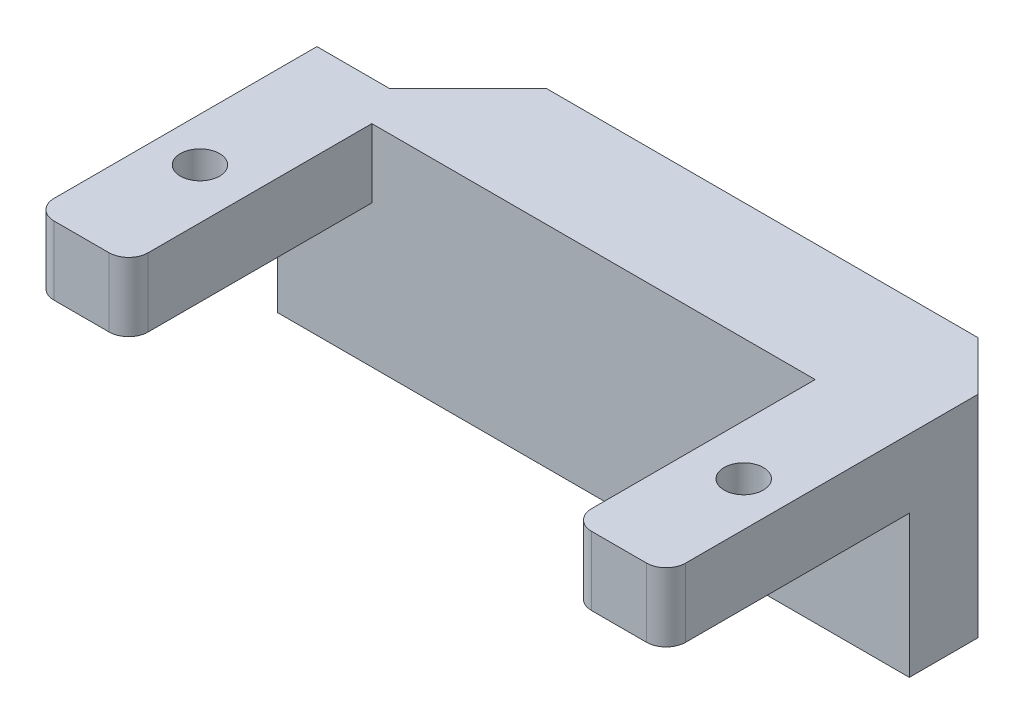
from build123d import *

# Parameters (mm, degrees)
SKETCH1_W           = 32.2
SKETCH1_H           = 25.5
BOSS_EXTRUDE1_DEPTH = 14.4
SKETCH3_W           = 32.2
SKETCH3_H           = 21.75
CUT_EXTRUDE1_DEPTH  = 12.4
SKETCH5_W           = 22.6
SKETCH5_H           = 2
CUT_EXTRUDE2_DEPTH  = 14.4
FILLET1_R           = 1
FILLET2_R           = 1
FILLET3_R           = 1
FILLET4_R           = 1
SKETCH10_R          = 1
CUT_EXTRUDE3_DEPTH  = 10
SKETCH11_W          = 4.85
SKETCH11_H          = 1.75
CUT_EXTRUDE4_DEPTH  = 20
FILLET5_R           = 1
SKETCH12_W          = 20
SKETCH12_H          = 2
BOSS_EXTRUDE2_DEPTH = 5
BOSS_EXTRUDE3_DEPTH = 5
SKETCH14_W          = 37.842545744
SKETCH14_H          = 22.134319208
CUT_EXTRUDE5_DEPTH  = 28.030214576
BOSS_EXTRUDE5_DEPTH = 3.75
CHAMFER1_SIZE       = 5
BOSS_EXTRUDE6_START = 1.5
SKETCH16_R          = 1
BOSS_EXTRUDE6_DEPTH = 1.5
SKETCH17_W          = 31.920460338
SKETCH17_H          = 22.260321026
CUT_EXTRUDE6_DEPTH  = 1


with BuildPart() as part:
    # Sketch1 → Boss-Extrude1 (new body)
    with BuildSketch(Plane.XY):
        Rectangle(SKETCH1_W, SKETCH1_H)
    extrude(amount=BOSS_EXTRUDE1_DEPTH)

    # Sketch3 → Cut-Extrude1 (cut)
    with BuildSketch(Plane.XY.offset(14.4)):
        with Locations((0, -0.125)):
            Rectangle(SKETCH3_W, SKETCH3_H)
    extrude(amount=-CUT_EXTRUDE1_DEPTH, mode=Mode.SUBTRACT)

    # Sketch5 → Cut-Extrude2 (cut)
    with BuildSketch(Plane.XY.offset(14.4)):
        with Locations((0, 11.75)):
            Rectangle(SKETCH5_W, SKETCH5_H)
    extrude(amount=-CUT_EXTRUDE2_DEPTH, mode=Mode.SUBTRACT)

    # Fillet1
    fillet1_edges = [part.edges().sort_by_distance(p)[0] for p in [
        (-11.3, 11.75, 14.4),
    ]]
    fillet(fillet1_edges, radius=FILLET1_R)

    # Fillet2
    fillet2_edges = [part.edges().sort_by_distance(p)[0] for p in [
        (-16.1, 11.75, 14.4),
    ]]
    fillet(fillet2_edges, radius=FILLET2_R)

    # Fillet3
    fillet3_edges = [part.edges().sort_by_distance(p)[0] for p in [
        (11.3, 11.75, 14.4),
    ]]
    fillet(fillet3_edges, radius=FILLET3_R)

    # Fillet4
    fillet4_edges = [part.edges().sort_by_distance(p)[0] for p in [
        (16.1, 11.75, 14.4),
    ]]
    fillet(fillet4_edges, radius=FILLET4_R)

    # Sketch10 → Cut-Extrude3 (cut)
    with BuildSketch(Plane(origin=(0, 12.75, 0), x_dir=(1, 0, 0), z_dir=(0, 1, 0))):
        with Locations(Location((-13.86, -8.203047487, 0), (0, 0, 270))):
            Circle(SKETCH10_R)
    cut_extrude3 = extrude(amount=-CUT_EXTRUDE3_DEPTH, mode=Mode.SUBTRACT)

    # Mirror1: Cut-Extrude3 across plane
    add(cut_extrude3.mirror(Plane(origin=(0, 0, 0), x_dir=(0, 0, 1), z_dir=(1, 0, 0))), mode=Mode.SUBTRACT)

    # Sketch11 → Cut-Extrude4 (cut)
    with BuildSketch(Plane.XY.offset(14.4)):
        with Locations((-13.675, -11.875)):
            Rectangle(SKETCH11_W, SKETCH11_H)
    cut_extrude4 = extrude(amount=-CUT_EXTRUDE4_DEPTH, mode=Mode.SUBTRACT)

    # Mirror2: Cut-Extrude4 across plane
    add(cut_extrude4.mirror(Plane(origin=(0, 0, 0), x_dir=(0, 0, 1), z_dir=(1, 0, 0))), mode=Mode.SUBTRACT)

    # Fillet5
    fillet5_edges = [part.edges().sort_by_distance(p)[0] for p in [
        (16.1, -11, 1),
        (11.25, -11.875, 14.4),
        (11.25, -11.875, 0),
        (-11.25, -11.875, 0),
        (-16.1, -11, 1),
        (-11.25, -11.875, 14.4),
    ]]
    fillet(fillet5_edges, radius=FILLET5_R)

    # Sketch12 → Boss-Extrude2 (add)
    with BuildSketch(Plane(origin=(0, 0, 0), x_dir=(-1, 0, 0), z_dir=(0, 0, -1))):
        with Locations((-2.6, 4.5)):
            Rectangle(SKETCH12_W, SKETCH12_H)
    extrude(amount=BOSS_EXTRUDE2_DEPTH)

    # Sketch13 → Boss-Extrude3 (add)
    with BuildSketch(Plane(origin=(0, 0, 0), x_dir=(-1, 0, 0), z_dir=(0, 0, -1))):
        Polygon((-12.6, 9), (7.4, 9), (7.4, 7), (7.4, 5.5), (6.4, 5.5), (6.4, 7), (-11.6, 7), (-11.6, 5.5), (-12.6, 5.5), (-12.6, 7), align=None)
    extrude(amount=BOSS_EXTRUDE3_DEPTH)

    # Sketch14 → Cut-Extrude5 (cut, through all)
    with BuildSketch(Plane.XZ.offset(-3.5)):
        with Locations((-0.315004543, 4.826001817)):
            Rectangle(SKETCH14_W, SKETCH14_H)
    extrude(amount=CUT_EXTRUDE5_DEPTH, mode=Mode.SUBTRACT)

    # Sketch15 → Boss-Extrude5 (add)
    with BuildSketch(Plane(origin=(0, 12.75, 0), x_dir=(1, 0, 0), z_dir=(0, 1, 0))):
        Polygon((11.3, 0), (12.6, 0), (12.6, 5), (-7.4, 5), (-7.4, 0), (-11.3, 0), (-11.3, -2), (11.3, -2), align=None)
    extrude(amount=-BOSS_EXTRUDE5_DEPTH)

    # Chamfer1
    # the kernel refuses this chamfer: 5 mm, written as the material it adds along each edge
    with BuildSketch(Plane(origin=(-7.4, 3.5, 0), x_dir=(-0.9996219169112968, 0, 0.027495876610586372), z_dir=(0, 1, 0))) as chamfer1_piece_1_section:
        Polygon((CHAMFER1_SIZE * 0.999621916911, -CHAMFER1_SIZE * 0.0274958766106), (-CHAMFER1_SIZE * 0.0274958766106, -CHAMFER1_SIZE * 0.999621916911), (0, 0), align=None)
    chamfer1_piece_1 = extrude(amount=9.25, mode=Mode.PRIVATE)
    chamfer1_piece_1 = split(chamfer1_piece_1, bisect_by=Plane(origin=(-9.052020772, 8.125, -5), z_dir=(0, 0, 1)), keep=Keep.TOP, mode=Mode.PRIVATE)
    add(chamfer1_piece_1)
    with BuildSketch(Plane(origin=(12.6, 3.5, 0), x_dir=(-0.027495876610586317, 0, -0.9996219169112968), z_dir=(0, 1, 0))) as chamfer1_piece_2_section:
        Polygon((CHAMFER1_SIZE * 0.999621916911, -CHAMFER1_SIZE * 0.0274958766106), (-CHAMFER1_SIZE * 0.0274958766106, -CHAMFER1_SIZE * 0.999621916911), (0, 0), align=None)
    chamfer1_piece_2 = extrude(amount=9.25, mode=Mode.PRIVATE)
    chamfer1_piece_2 = split(chamfer1_piece_2, bisect_by=Plane(origin=(16.1, 8.125, -1.788652221), z_dir=(-1, 0, 0)), keep=Keep.TOP, mode=Mode.PRIVATE)
    chamfer1_piece_2 = split(chamfer1_piece_2, bisect_by=Plane(origin=(13.973224067, 8.125, -5), z_dir=(0, 0, 1)), keep=Keep.TOP, mode=Mode.PRIVATE)
    add(chamfer1_piece_2)

    # Sketch16 → Boss-Extrude6 (add)
    with BuildSketch(Plane(origin=(0, 12.75, 0), x_dir=(1, 0, 0), z_dir=(0, 1, 0)).offset(BOSS_EXTRUDE6_START)):
        with BuildLine():
            Line((16.1, -13.4), (16.1, 1.5))
            Line((16.1, 1.5), (12.6, 5))
            Line((12.6, 5), (-7.4, 5))
            Line((-7.4, 5), (-12.4, 0))
            Line((-12.4, 0), (-16.1, 0))
            Line((-16.1, 0), (-16.1, -13.4))
            ThreePointArc((-16.1, -13.4), (-15.807106781, -14.107106781), (-15.1, -14.4))
            Line((-15.1, -14.4), (-12.3, -14.4))
            ThreePointArc((-12.3, -14.4), (-11.592893219, -14.107106781), (-11.3, -13.4))
            Line((-11.3, -13.4), (-11.3, -2))
            Line((-11.3, -2), (11.3, -2))
            Line((11.3, -2), (11.3, -13.4))
            ThreePointArc((11.3, -13.4), (11.592893219, -14.107106781), (12.3, -14.4))
            Line((12.3, -14.4), (15.1, -14.4))
            ThreePointArc((15.1, -14.4), (15.807106781, -14.107106781), (16.1, -13.4))
        make_face()
        with Locations(Location((13.86, -8.203047487, 0), (0, 0, 270))):
            Circle(SKETCH16_R, mode=Mode.SUBTRACT)
        with Locations(Location((-13.86, -8.203047487, 0), (0, 0, 270))):
            Circle(SKETCH16_R, mode=Mode.SUBTRACT)
    extrude(amount=-BOSS_EXTRUDE6_DEPTH)

    # Sketch17 → Cut-Extrude6 (cut)
    with BuildSketch(Plane(origin=(0, 0, -5), x_dir=(-1, 0, 0), z_dir=(0, 0, -1))):
        with Locations((-2.436035131, 9.274005754)):
            Rectangle(SKETCH17_W, SKETCH17_H)
    extrude(amount=-CUT_EXTRUDE6_DEPTH, mode=Mode.SUBTRACT)


solid = part.part
